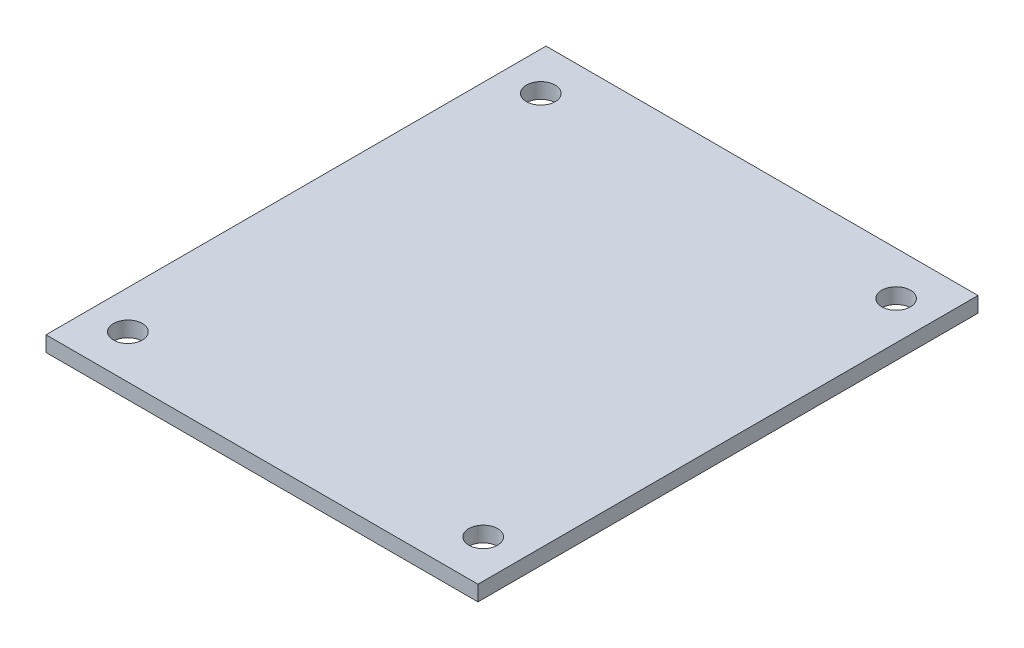
from build123d import *

# Parameters (mm, degrees)
SKETCH1_W           = 44.9834
SKETCH1_H           = 52.07
SKETCH1_R           = 1.5
BOSS_EXTRUDE1_DEPTH = 1.6


with BuildPart() as part:
    # Sketch1 → Boss-Extrude1 (new body)
    with BuildSketch(Plane(origin=(0, 0, 0), x_dir=(1, 0, 0), z_dir=(0, 1, 0))):
        with Locations((22.4917, 26.035)):
            Rectangle(SKETCH1_W, SKETCH1_H)
        with Locations((3.9917, 47.535)):
            Circle(SKETCH1_R, mode=Mode.SUBTRACT)
        with Locations((40.9917, 47.535)):
            Circle(SKETCH1_R, mode=Mode.SUBTRACT)
        with Locations((40.9917, 4.535)):
            Circle(SKETCH1_R, mode=Mode.SUBTRACT)
        with Locations((3.9917, 4.535)):
            Circle(SKETCH1_R, mode=Mode.SUBTRACT)
    extrude(amount=BOSS_EXTRUDE1_DEPTH)


solid = part.part
